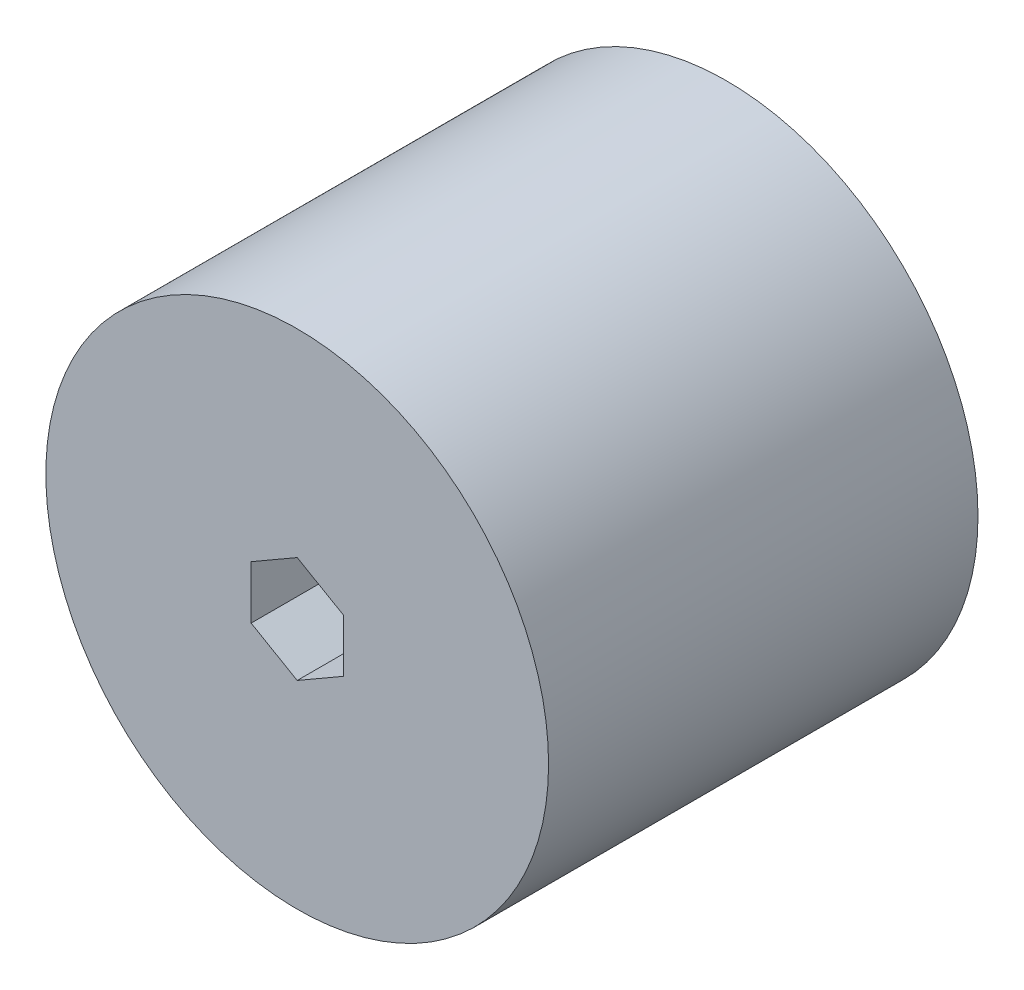
from build123d import *

# Parameters (mm, degrees)
SKETCH1_R           = 38.1
BOSS_EXTRUDE1_DEPTH = 65.0875


with BuildPart() as part:
    # Sketch1 → Boss-Extrude1 (new body)
    with BuildSketch(Plane.XY):
        Circle(SKETCH1_R)
        Polygon((0, 8.065583261), (-6.985, 4.03279163), (-6.985, -4.03279163), (0, -8.065583261), (6.985, -4.03279163), (6.985, 4.03279163), align=None, mode=Mode.SUBTRACT)
    extrude(amount=BOSS_EXTRUDE1_DEPTH)


solid = part.part
